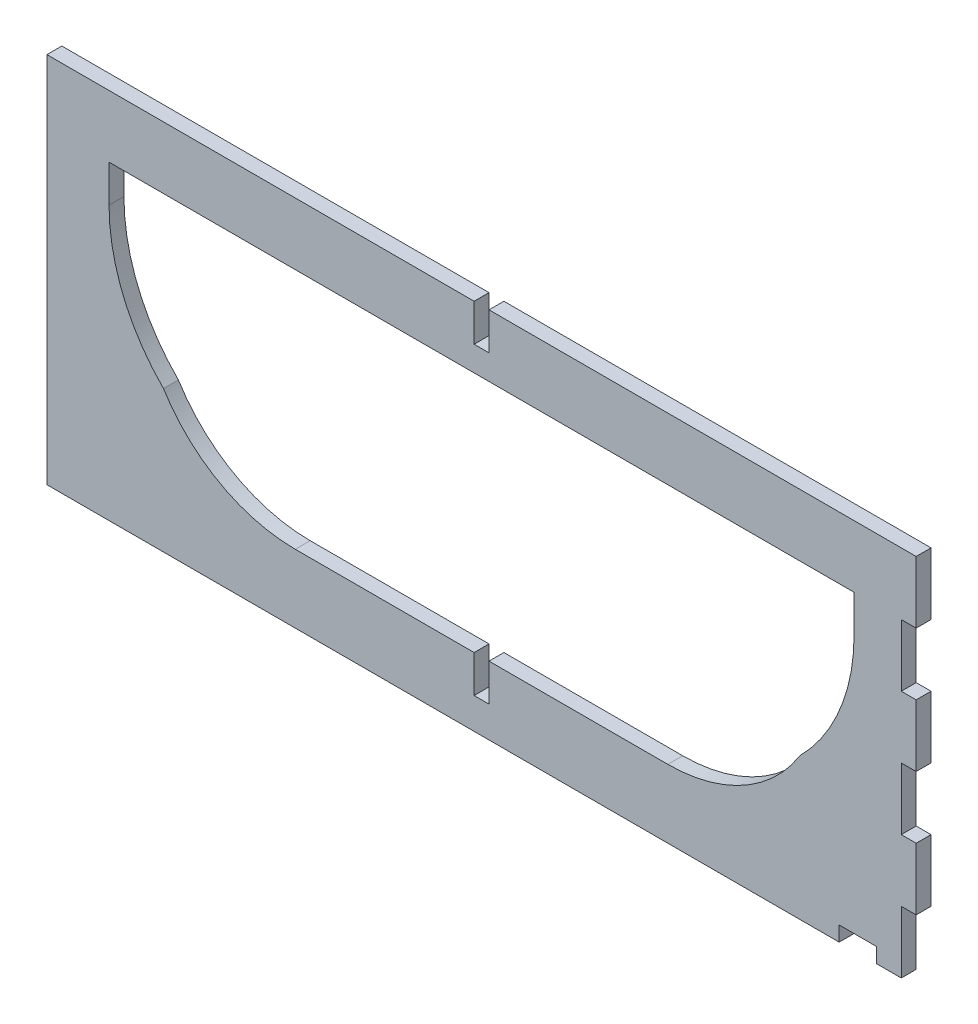
from build123d import *

# Parameters (mm, degrees)
SKETCH1_W           = 200
SKETCH1_H           = 150
BOSS_EXTRUDE1_DEPTH = 6
SKETCH3_W           = 100
SKETCH3_H           = 97.5
CUT_EXTRUDE1_DEPTH  = 6
BOSS_EXTRUDE3_DEPTH = 6
SKETCH5_W           = 6
SKETCH5_H           = 15
CUT_EXTRUDE2_DEPTH  = 6
SKETCH6_W           = 6
SKETCH6_H           = 25
CUT_EXTRUDE3_DEPTH  = 6
LPATTERN1_COUNT     = 3
LPATTERN1_PITCH     = 50
SKETCH7_W           = 15
SKETCH7_H           = 6
CUT_EXTRUDE_S_DEPTH = 381.835922675


with BuildPart() as part:
    # Sketch1 → Boss-Extrude1 (new body)
    with BuildSketch(Plane.XY):
        with Locations((-100, 75)):
            Rectangle(SKETCH1_W, SKETCH1_H)
        with BuildLine():
            Line((-175, 110), (-175, 125))
            Line((-175, 125), (-25, 125))
            Line((-25, 125), (-25, 110))
            ThreePointArc((-25, 110), (-30.691670032, 81.340701386), (-46.902810588, 57.03125))
            ThreePointArc((-46.902810588, 57.03125), (-100, 27.5), (-153.097189412, 57.03125))
            ThreePointArc((-153.097189412, 57.03125), (-169.308329968, 81.340701386), (-175, 110))
        make_face(mode=Mode.SUBTRACT)
    extrude(amount=BOSS_EXTRUDE1_DEPTH)

    # Sketch3 → Cut-Extrude1 (cut)
    with BuildSketch(Plane.XY.offset(6)):
        with Locations((-150, 76.25)):
            Rectangle(SKETCH3_W, SKETCH3_H)
    extrude(amount=-CUT_EXTRUDE1_DEPTH, mode=Mode.SUBTRACT)

    # Sketch4 → Boss-Extrude3 (add)
    with BuildSketch(Plane.XY.offset(6)):
        with BuildLine():
            Line((-200, 27.5), (-250, 27.5))
            ThreePointArc((-250, 27.5), (-280.378472024, 35.379505335), (-303.097189412, 57.03125))
            ThreePointArc((-303.097189412, 57.03125), (-319.308329968, 81.340701386), (-325, 110))
            Line((-325, 110), (-325, 125))
            Line((-325, 125), (-200, 125))
            Line((-200, 125), (-200, 150))
            Line((-200, 150), (-350, 150))
            Line((-350, 150), (-350, 0))
            Line((-350, 0), (-200, 0))
            Line((-200, 0), (-200, 27.5))
        make_face()
    extrude(amount=-BOSS_EXTRUDE3_DEPTH)

    # Sketch5 → Cut-Extrude2 (cut)
    with BuildSketch(Plane.XY.offset(6)):
        with Locations((-175, 142.5)):
            Rectangle(SKETCH5_W, SKETCH5_H)
        with Locations((-175, 20)):
            Rectangle(SKETCH5_W, SKETCH5_H)
    extrude(amount=-CUT_EXTRUDE2_DEPTH, mode=Mode.SUBTRACT)

    # Sketch6 → Cut-Extrude3 (cut)
    with BuildSketch(Plane.XY.offset(6)):
        with Locations((-3, 112.5)):
            Rectangle(SKETCH6_W, SKETCH6_H)
    cut_extrude3 = extrude(amount=-CUT_EXTRUDE3_DEPTH, mode=Mode.SUBTRACT)

    # LPattern1: Cut-Extrude3 ×3
    with Locations(*[(0, -i * LPATTERN1_PITCH, 0) for i in range(1, LPATTERN1_COUNT)]):
        add(cut_extrude3, mode=Mode.SUBTRACT)

    # Sketch7 → Cut-Extrude s (cut, through all)
    with BuildSketch(Plane.XY.offset(6)):
        with Locations((-23.5, 3)):
            Rectangle(SKETCH7_W, SKETCH7_H)
    extrude(amount=-CUT_EXTRUDE_S_DEPTH, mode=Mode.SUBTRACT)


solid = part.part
